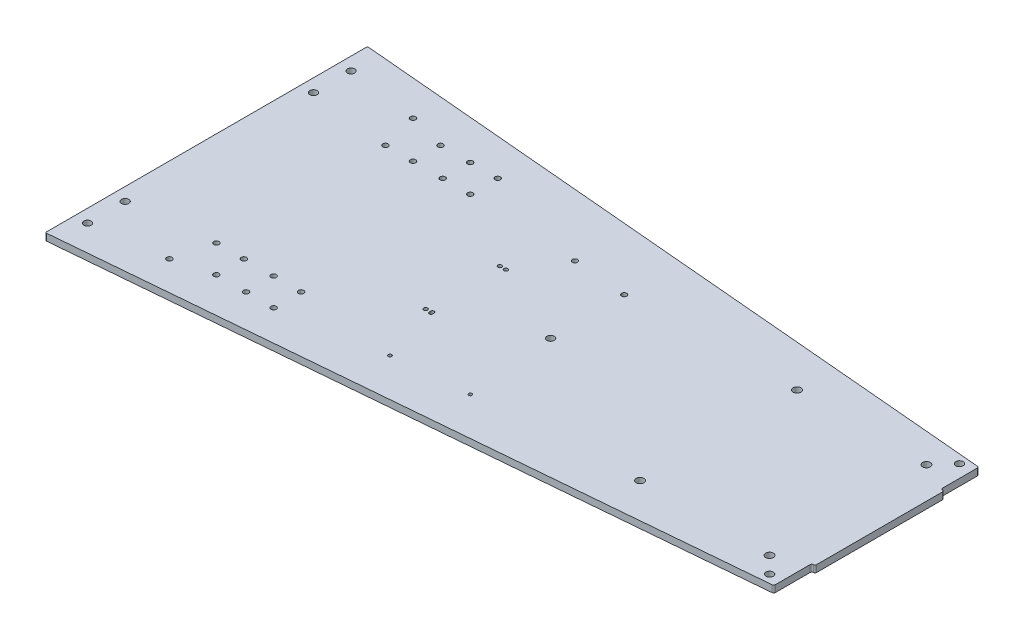
from build123d import *

# Parameters (mm, degrees)
BOSS_EXTRUDE1_DEPTH         = 3.175
M3_CLEARANCE_HOLE1_D        = 3.6
F_1_4_CLEARANCE_HOLE1_D     = 7.14248
CUT_EXTRUDE1_DEPTH          = 640.11012417
F_8_CLEARANCE_HOLE1_D       = 4.9149
SKETCH15_R                  = 1.55
CUT_EXTRUDE2_DEPTH          = 640.11012417
SKETCH16_R                  = 3.3782
CUT_EXTRUDE3_DEPTH          = 640.11012417
FILLET1_R                   = 1
CUT_EXTRUDE4_DEPTH          = 640.088878697
FILLET2_R                   = 1.5
F_13_0_185_DIAMETER_HOLE1_D = 4.699
F_1_4_CLEARANCE_HOLE2_D     = 6.7564


with BuildPart() as part:
    # Sketch1 → Boss-Extrude1 (new, symmetric)
    with BuildSketch(Plane(origin=(0, 0, 0), x_dir=(1, 0, 0), z_dir=(0, 1, 0))):
        Polygon((0, -94.3735), (0, 94.3735), (-621.526239041, 148.75), (-621.526239041, -148.75), align=None)
    extrude(amount=BOSS_EXTRUDE1_DEPTH, both=True)

    # M3 Clearance Hole1 (through all)
    with Locations(Plane(origin=(0, 3.175, 0), x_dir=(1, 0, 0), z_dir=(0, 1, 0))):
        with Locations((-379.222, 34.29), (-384.81, 34.29), (-384.81, -34.29)):
            Hole(M3_CLEARANCE_HOLE1_D / 2)

    # 1/4 Clearance Hole1 (through all)
    with Locations(Plane(origin=(0, 3.175, 0), x_dir=(1, 0, 0), z_dir=(0, 1, 0))):
        with Locations((-29.147346667, 72.452653333), (-29.147346667, -72.452653333), (-148.652653333, -72.452653333), (-148.652653333, 72.452653333)):
            Hole(F_1_4_CLEARANCE_HOLE1_D / 2)

    # Sketch12 → Cut-Extrude1 (cut, through all)
    with BuildSketch(Plane(origin=(0, 3.175, 0), x_dir=(1, 0, 0), z_dir=(0, 1, 0))):
        with BuildLine():
            Line((-380.84125, -33.6169), (-380.84125, -34.0868))
            ThreePointArc((-380.84125, -34.0868), (-380.85395, -34.29), (-380.84125, -34.4932))
            Line((-380.84125, -34.4932), (-380.84125, -34.9631))
            ThreePointArc((-380.84125, -34.9631), (-379.222, -36.58235), (-377.60275, -34.9631))
            Line((-377.60275, -34.9631), (-377.60275, -34.4932))
            ThreePointArc((-377.60275, -34.4932), (-377.59005, -34.29), (-377.60275, -34.0868))
            Line((-377.60275, -34.0868), (-377.60275, -33.6169))
            ThreePointArc((-377.60275, -33.6169), (-379.222, -31.99765), (-380.84125, -33.6169))
        make_face()
    extrude(amount=-CUT_EXTRUDE1_DEPTH, mode=Mode.SUBTRACT)

    # #8 Clearance Hole1 (through all)
    with Locations(Plane(origin=(0, 3.175, 0), x_dir=(1, 0, 0), z_dir=(0, 1, 0))):
        with Locations((-508.833140591, -78.064272283), (-508.833140591, -103.464272283), (-543.213396712, -112.444528404), (-534.233140591, -78.064272283), (-481.407885674, -78.064272283), (-481.407885674, -103.464272283), (-456.007885674, -78.064272283), (-456.007885674, -103.464272283), (-456.007885674, 78.064272283), (-456.007885674, 103.464272283), (-481.407885674, 78.064272283), (-481.407885674, 103.464272283), (-543.213396712, 112.444528404), (-534.233140591, 78.064272283), (-508.833140591, 103.464272283), (-508.833140591, 78.064272283)):
            Hole(F_8_CLEARANCE_HOLE1_D / 2)

    # Sketch15 → Cut-Extrude2 (cut, through all)
    with BuildSketch(Plane(origin=(0, 3.175, 0), x_dir=(1, 0, 0), z_dir=(0, 1, 0))):
        with Locations(Location((-295.918163181, -81.916960017, 0), (0, 0, 270))):
            Circle(SKETCH15_R)
        with Locations(Location((-364.1575, -87.887128395, 0), (0, 0, 270))):
            Circle(SKETCH15_R)
    extrude(amount=-CUT_EXTRUDE2_DEPTH, mode=Mode.SUBTRACT)

    # Sketch16 → Cut-Extrude3 (cut, through all)
    with BuildSketch(Plane(origin=(0, 3.175, 0), x_dir=(1, 0, 0), z_dir=(0, 1, 0))):
        with Locations(Location((-609.6000104, -121.650317511, 0), (0, 0, 270))):
            Circle(SKETCH16_R)
        with Locations(Location((-609.6000104, -86.943080709, 0), (0, 0, 270))):
            Circle(SKETCH16_R)
        with Locations(Location((-609.6000104, 86.943080709, 0), (0, 0, 270))):
            Circle(SKETCH16_R)
        with Locations(Location((-609.6000104, 121.650317511, 0), (0, 0, 270))):
            Circle(SKETCH16_R)
    extrude(amount=-CUT_EXTRUDE3_DEPTH, mode=Mode.SUBTRACT)

    # Fillet1
    fillet1_edges = [part.edges().sort_by_distance(p)[0] for p in [
        (-621.526239041, 0, 148.75),
        (-621.526239041, 0, -148.75),
    ]]
    fillet(fillet1_edges, radius=FILLET1_R)

    # Sketch17 → Cut-Extrude4 (cut, through all)
    with BuildSketch(Plane(origin=(0, 3.175, 0), x_dir=(1, 0, 0), z_dir=(0, 1, 0))):
        Polygon((-3, 94.635965991), (-3, 59.635965991), (0, 59.635965991), (0, 94.3735), align=None)
    cut_extrude4 = extrude(amount=-CUT_EXTRUDE4_DEPTH, mode=Mode.SUBTRACT)

    # Mirror1: Cut-Extrude4 across plane
    add(cut_extrude4.mirror(Plane.XY), mode=Mode.SUBTRACT)

    # Fillet2
    fillet2_edges = [part.edges().sort_by_distance(p)[0] for p in [
        (0, 0, -59.635965991),
        (-3, 0, -59.635965991),
        (-3, 0, -94.635965991),
        (0, 0, 59.635965991),
        (-3, 0, 59.635965991),
        (-3, 0, 94.635965991),
    ]]
    fillet(fillet2_edges, radius=FILLET2_R - 0.0001)  # a hair under: the kernel refuses the full size

    # #13 (0.185) Diameter Hole1 (through all)
    with Locations(Plane(origin=(0, 3.175, 0), x_dir=(1, 0, 0), z_dir=(0, 1, 0))):
        with Locations((-354.44558465, 73.187743603), (-304.635849746, 68.829956465)):
            Hole(F_13_0_185_DIAMETER_HOLE1_D / 2)

    # 1/4 Clearance Hole2 (through all)
    with Locations(Plane(origin=(0, 3.175, 0), x_dir=(1, 0, 0), z_dir=(0, 1, 0))):
        with Locations((-14.732, 88.469940408), (-14.0462, -87.453940528), (-303.7332, 0)):
            Hole(F_1_4_CLEARANCE_HOLE2_D / 2)


solid = part.part
